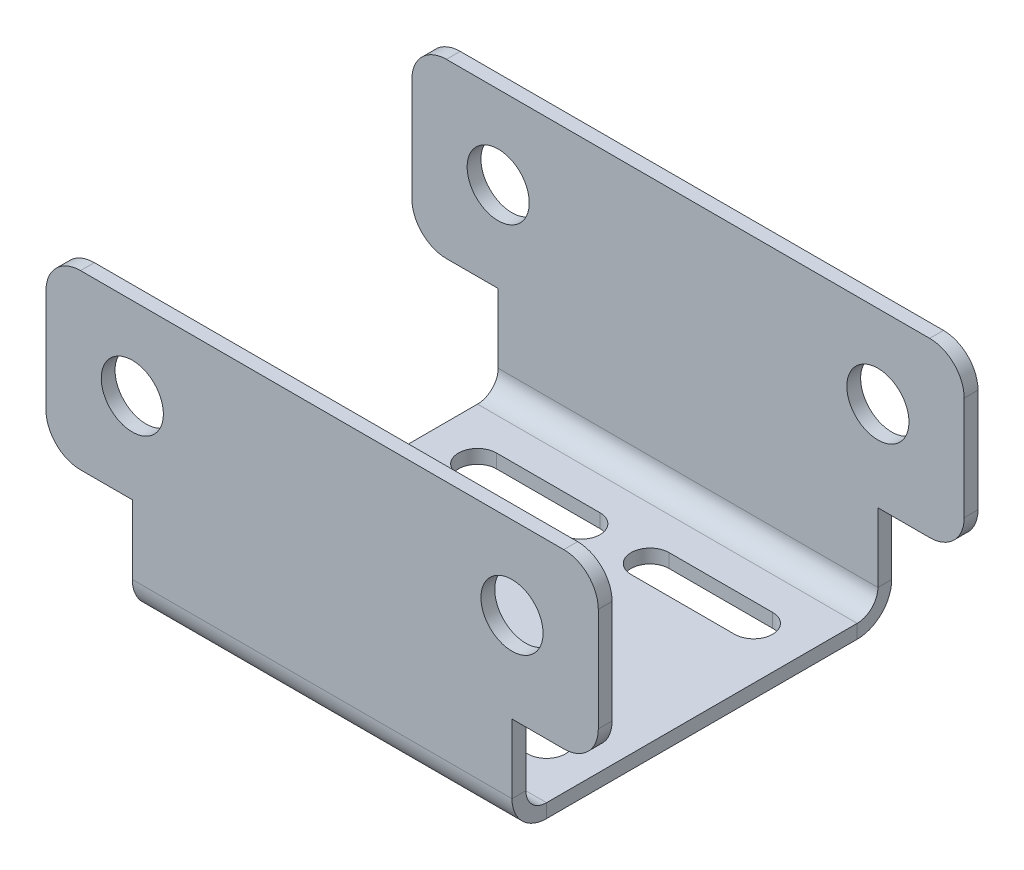
from build123d import *

# Parameters (mm, degrees)
ODGI_CIE_BAZOWE1_DEPTH      = 40
SZCZELINA_POD_RUB_M52_DEPTH = 2
OTW_R_POD_RUB_M81_D         = 9
SZKIC10_W                   = 12.5
SZKIC10_H                   = 15
WYTNIJ_WYCI_GNI_CIE1_DEPTH  = 79.89866919
ZAOKR_GLENIE1_R             = 5


# Read off the part's stored shape, not the designer's step: Szczelina pod śrubę M52
# Sheet-metal steps are written as plain solids
with BuildPart() as part:
    # Szkic1 → Odgięcie bazowe1 (new, symmetric)
    with BuildSketch(Plane(origin=(0, 0, 0), x_dir=(0, 0, -1), z_dir=(1, 0, 0))):
        with BuildLine():
            Line((27.5, 40), (27.5, 5))
            ThreePointArc((27.5, 5), (26.035533906, 1.464466094), (22.5, 0))
            Line((22.5, 0), (-22.5, 0))
            ThreePointArc((-22.5, 0), (-26.035533906, 1.464466094), (-27.5, 5))
            Line((-27.5, 5), (-27.5, 40))
            Line((-27.5, 40), (-25.5, 40))
            Line((-25.5, 40), (-25.5, 5))
            ThreePointArc((-25.5, 5), (-24.621320344, 2.878679656), (-22.5, 2))
            Line((-22.5, 2), (22.5, 2))
            ThreePointArc((22.5, 2), (24.621320344, 2.878679656), (25.5, 5))
            Line((25.5, 5), (25.5, 40))
            Line((25.5, 40), (27.5, 40))
        make_face()
    extrude(amount=ODGI_CIE_BAZOWE1_DEPTH, both=True)

    # Szczelina pod śrubę M52 outline → Szczelina pod śrubę M52 (cut)
    with BuildSketch(Plane(origin=(0, 0, 0), x_dir=(1, 0, 0), z_dir=(0, 1, 0))):
        with BuildLine():
            ThreePointArc((5, -12.25), (2.25, -15), (5, -17.75))
            Line((5, -17.75), (20, -17.75))
            ThreePointArc((20, -17.75), (22.75, -15), (20, -12.25))
            Line((20, -12.25), (5, -12.25))
        make_face()
        with BuildLine():
            ThreePointArc((-20, -12.25), (-22.75, -15), (-20, -17.75))
            Line((-20, -17.75), (-5, -17.75))
            ThreePointArc((-5, -17.75), (-2.25, -15), (-5, -12.25))
            Line((-5, -12.25), (-20, -12.25))
        make_face()
        with BuildLine():
            ThreePointArc((-5, 12.25), (-2.25, 15), (-5, 17.75))
            Line((-5, 17.75), (-20, 17.75))
            ThreePointArc((-20, 17.75), (-22.75, 15), (-20, 12.25))
            Line((-20, 12.25), (-5, 12.25))
        make_face()
        with BuildLine():
            ThreePointArc((20, 12.25), (22.75, 15), (20, 17.75))
            Line((20, 17.75), (5, 17.75))
            ThreePointArc((5, 17.75), (2.25, 15), (5, 12.25))
            Line((5, 12.25), (20, 12.25))
        make_face()
    extrude(amount=SZCZELINA_POD_RUB_M52_DEPTH, mode=Mode.SUBTRACT)

    # Otwór pod śrubę M81 (through all)
    with Locations(Plane(origin=(0, 0, -27.5), x_dir=(-1, 0, 0), z_dir=(0, 0, -1))):
        with Locations((-27.5, 28), (27.5, 28)):
            Hole(OTW_R_POD_RUB_M81_D / 2)

    # Szkic10 → Wytnij-wyciągnięcie1 (cut, through all)
    with BuildSketch(Plane(origin=(0, 0, -27.5), x_dir=(-1, 0, 0), z_dir=(0, 0, -1))):
        with Locations((-33.75, 7.5)):
            Rectangle(SZKIC10_W, SZKIC10_H)
        with Locations((33.75, 7.5)):
            Rectangle(SZKIC10_W, SZKIC10_H)
    extrude(amount=-WYTNIJ_WYCI_GNI_CIE1_DEPTH, mode=Mode.SUBTRACT)

    # Zaokrąglenie1
    zaokr_glenie1_edges = [part.edges().sort_by_distance(p)[0] for p in [
        (-40, 40, -26.5),
        (-40, 40, 26.5),
        (40, 15, -26.5),
        (40, 15, 26.5),
        (-40, 15, -26.5),
        (-40, 15, 26.5),
        (40, 40, -26.5),
        (40, 40, 26.5),
    ]]
    fillet(zaokr_glenie1_edges, radius=ZAOKR_GLENIE1_R)


solid = part.part
